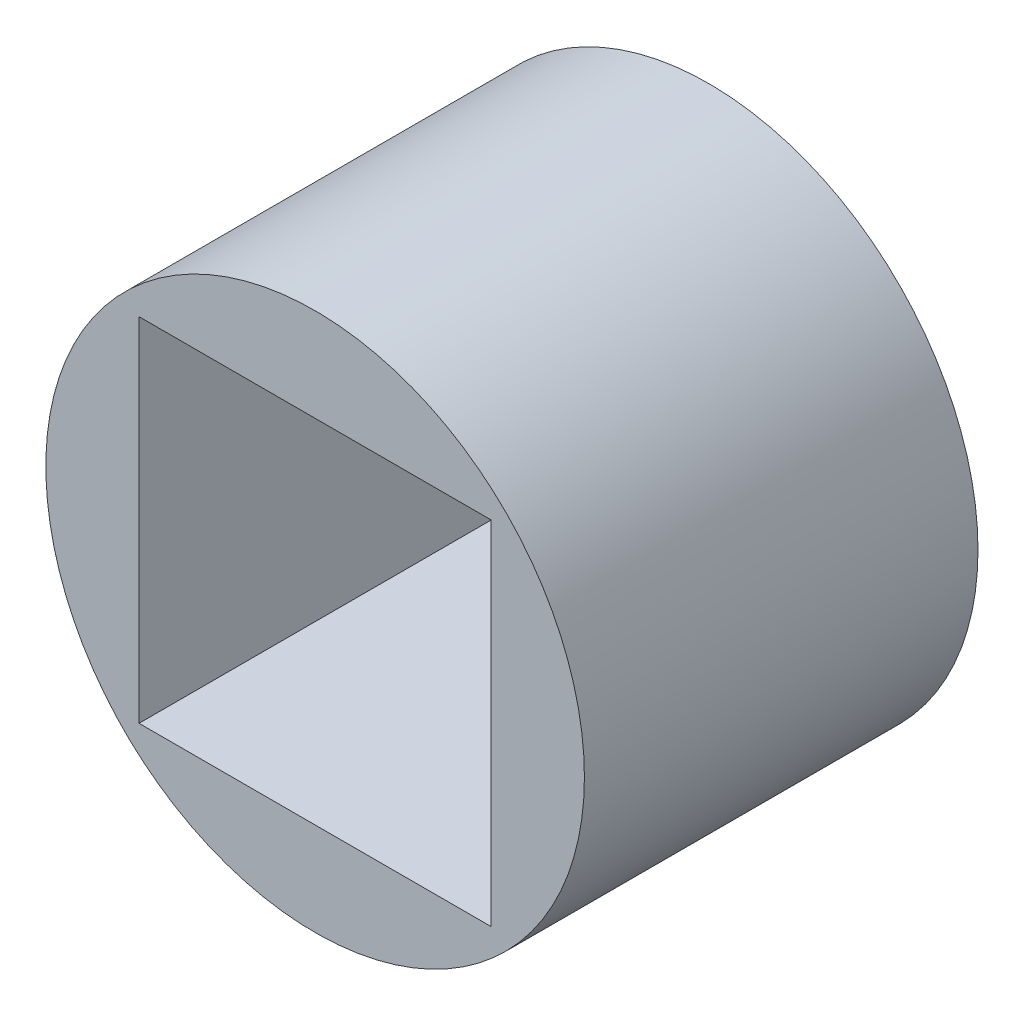
from build123d import *

# Parameters (mm, degrees)
SKETCH1_R           = 13
BOSS_EXTRUDE1_DEPTH = 19
SKETCH2_W           = 17
SKETCH2_H           = 17
CUT_EXTRUDE1_DEPTH  = 27.438608133
SKETCH3_W           = 1.338100332
SKETCH3_H           = 0.399847574
CUT_EXTRUDE2_DEPTH  = 1


with BuildPart() as part:
    # Sketch1 → Boss-Extrude1 (new body)
    with BuildSketch(Plane.XY):
        Circle(SKETCH1_R)
    extrude(amount=BOSS_EXTRUDE1_DEPTH)

    # Sketch2 → Cut-Extrude1 (cut, through all)
    with BuildSketch(Plane(origin=(0, 0, 0), x_dir=(-1, 0, 0), z_dir=(0, 0, -1))):
        Rectangle(SKETCH2_W, SKETCH2_H)
    extrude(amount=-CUT_EXTRUDE1_DEPTH, mode=Mode.SUBTRACT)

    # Sketch3 → Cut-Extrude2 (cut)
    with BuildSketch(Plane.XZ.offset(-8.5)):
        with BuildLine():
            add(Edge.make_bspline(
                [(-3.825462561, 7.998501817), (-3.8472395, 7.988683923), (-3.892165727, 7.968429426), (-3.964656685, 7.943438913), (-4.043322709, 7.920849207), (-4.158034022, 7.895766454), (-4.309873, 7.872453456), (-4.434074011, 7.868540933), (-4.497297615, 7.866549292)],
                knots=[0, 0, 0, 0, 0.623279357, 1.285836859, 1.999327964, 2.758722695, 4.350051821, 6, 6, 6, 6], degree=3))
            add(Edge.make_bspline(
                [(-4.497297615, 7.866549292), (-4.544517066, 7.867822116), (-4.636711485, 7.870307262), (-4.771142319, 7.888042222), (-4.897562598, 7.917463191), (-5.016054988, 7.958445975), (-5.126623729, 8.010722712), (-5.229306121, 8.07453212), (-5.324479717, 8.149401281), (-5.410267642, 8.236733372), (-5.488079827, 8.33375156), (-5.555215307, 8.441917538), (-5.612334828, 8.55986778), (-5.658692932, 8.6883202), (-5.695097594, 8.826651983), (-5.721458052, 8.974968663), (-5.738832003, 9.133266205), (-5.741316176, 9.242265926), (-5.742595401, 9.298395362)],
                knots=[0, 0, 0, 0, 1.05357022, 2.05706105, 3.019831997, 3.945549259, 4.849673394, 5.743319306, 6.637992512, 7.545159443, 8.469260999, 9.40786221, 10.379774602, 11.388606811, 12.450446757, 13.567948197, 14.747614263, 16, 16, 16, 16], degree=3))
            add(Edge.make_bspline(
                [(-5.742595401, 9.298395362), (-5.740839555, 9.357344336), (-5.737431344, 9.4717681), (-5.71890081, 9.637393975), (-5.69061878, 9.792016173), (-5.650226431, 9.934755031), (-5.601314628, 10.067238307), (-5.540767632, 10.187969396), (-5.469289697, 10.297433174), (-5.387211374, 10.394753746), (-5.297112011, 10.480418745), (-5.200605572, 10.555325418), (-5.097298035, 10.618118111), (-4.987570233, 10.669800158), (-4.871437604, 10.709993799), (-4.749081641, 10.738915058), (-4.620270899, 10.755991273), (-4.532312435, 10.758052252), (-4.487442234, 10.759103618)],
                knots=[0, 0, 0, 0, 1.300058967, 2.523498372, 3.671327638, 4.762385131, 5.790754738, 6.781204902, 7.734179646, 8.667035103, 9.582038544, 10.471113154, 11.35590086, 12.242457161, 13.14087904, 14.060872889, 15.010794189, 16, 16, 16, 16], degree=3))
            add(Edge.make_bspline(
                [(-4.487442234, 10.759103618), (-4.453635771, 10.758545443), (-4.387809068, 10.757458584), (-4.291923773, 10.749549681), (-4.20157498, 10.737252335), (-4.117208774, 10.719144041), (-4.038155251, 10.699104788), (-3.965344922, 10.675556536), (-3.89768, 10.651537073), (-3.855861028, 10.632007753), (-3.835579176, 10.622536196)],
                knots=[0, 0, 0, 0, 1.208363836, 2.352881735, 3.437133088, 4.465326887, 5.435785295, 6.351019915, 7.200258411, 8, 8, 8, 8], degree=3))
            Line((-3.835579176, 10.622536196), (-3.713548715, 11.067115898))
            add(Edge.make_bspline(
                [(-3.713548715, 11.067115898), (-3.728780614, 11.074271907), (-3.763638168, 11.090648133), (-3.825085739, 11.111773726), (-3.901694354, 11.133026165), (-3.992569237, 11.156840394), (-4.099406756, 11.177391064), (-4.221778647, 11.191208874), (-4.359395075, 11.201365109), (-4.456212288, 11.203094008), (-4.507152996, 11.204003675)],
                knots=[0, 0, 0, 0, 0.497728815, 1.139031319, 1.919228026, 2.850533018, 3.918187005, 5.13515125, 6.492650013, 8, 8, 8, 8], degree=3))
            add(Edge.make_bspline(
                [(-4.507152996, 11.204003675), (-4.571520854, 11.202585263), (-4.697641023, 11.199806077), (-4.882374145, 11.175960191), (-5.057963075, 11.137542756), (-5.224767045, 11.083826883), (-5.382484292, 11.014738446), (-5.530921996, 10.929705154), (-5.670480956, 10.829901405), (-5.800125021, 10.715128055), (-5.918300001, 10.585476353), (-6.021609971, 10.440161667), (-6.109032731, 10.280044465), (-6.18091872, 10.105477848), (-6.237630959, 9.916766953), (-6.27970982, 9.713764265), (-6.306513382, 9.49617978), (-6.312056921, 9.346106465), (-6.314911455, 9.268829219)],
                knots=[0, 0, 0, 0, 1.03258902, 2.023219463, 2.983439502, 3.913466857, 4.830690834, 5.741453413, 6.65369381, 7.579319873, 8.515001589, 9.462699019, 10.433390624, 11.436184352, 12.486830696, 13.590904696, 14.759484638, 16, 16, 16, 16], degree=3))
            add(Edge.make_bspline(
                [(-6.314911455, 9.268829219), (-6.313035244, 9.195777488), (-6.309387091, 9.053733849), (-6.284596459, 8.847436339), (-6.247972277, 8.653778259), (-6.196856679, 8.472860413), (-6.131020876, 8.305138456), (-6.052331856, 8.149546165), (-5.957972622, 8.007596821), (-5.850982138, 7.878083443), (-5.730885174, 7.763539926), (-5.600843462, 7.662547159), (-5.459882189, 7.57781128), (-5.308694946, 7.50846802), (-5.147248795, 7.454247123), (-4.975395794, 7.414929133), (-4.79316224, 7.390811315), (-4.668198211, 7.386994984), (-4.604298894, 7.385043535)],
                knots=[0, 0, 0, 0, 1.218475598, 2.369234888, 3.461691683, 4.503752951, 5.500362793, 6.463244622, 7.406714516, 8.337948286, 9.259888006, 10.169706265, 11.079364509, 11.997173012, 12.939204436, 13.91536257, 14.934038004, 16, 16, 16, 16], degree=3))
            add(Edge.make_bspline(
                [(-4.604298894, 7.385043535), (-4.555000004, 7.385679709), (-4.459818747, 7.386907969), (-4.321997417, 7.397410376), (-4.194090481, 7.411475091), (-4.07661829, 7.431836437), (-3.97113093, 7.456597699), (-3.877897968, 7.48218342), (-3.79789667, 7.509696951), (-3.750484492, 7.531808929), (-3.728577896, 7.542025675)],
                knots=[0, 0, 0, 0, 1.319898282, 2.548324642, 3.699499855, 4.764539851, 5.738494737, 6.599877469, 7.353079316, 8, 8, 8, 8], degree=3))
            Line((-3.728577896, 7.542025675), (-3.825462561, 7.998501817))
        make_face()
        with BuildLine():
            add(Edge.make_bspline(
                [(-1.241951013, 11.044182338), (-1.263788296, 11.05396615), (-1.309962054, 11.074653493), (-1.38472728, 11.104174743), (-1.470203266, 11.128880989), (-1.564058953, 11.155217532), (-1.667821691, 11.175784789), (-1.780277996, 11.192416001), (-1.902159788, 11.20087307), (-1.986277734, 11.202934073), (-2.029932584, 11.204003675)],
                knots=[0, 0, 0, 0, 0.708710674, 1.498530526, 2.377842287, 3.342082284, 4.384700519, 5.508033759, 6.706739533, 8, 8, 8, 8], degree=3))
            add(Edge.make_bspline(
                [(-2.029932584, 11.204003675), (-2.075971056, 11.202857752), (-2.16570689, 11.200624179), (-2.296186023, 11.185165496), (-2.419347876, 11.163065719), (-2.534860232, 11.132343992), (-2.642812237, 11.092755462), (-2.742994253, 11.044544729), (-2.836723704, 10.989420863), (-2.921086311, 10.924115344), (-2.996955513, 10.852605042), (-3.063829961, 10.775469394), (-3.120570115, 10.692592598), (-3.167043924, 10.604159061), (-3.204304263, 10.510610715), (-3.229688087, 10.41117863), (-3.247510652, 10.306614747), (-3.250016873, 10.234733851), (-3.251295873, 10.198050856)],
                knots=[0, 0, 0, 0, 1.244497242, 2.425710392, 3.548112764, 4.625356038, 5.653037026, 6.651879843, 7.627834546, 8.587130278, 9.529579358, 10.442724556, 11.341923041, 12.238701188, 13.138772083, 14.057454209, 15.008660164, 16, 16, 16, 16], degree=3))
            add(Edge.make_bspline(
                [(-3.251295873, 10.198050856), (-3.249901851, 10.167042997), (-3.247155688, 10.105958848), (-3.234778001, 10.016225759), (-3.213068318, 9.930681627), (-3.185324334, 9.848274231), (-3.148133318, 9.770135774), (-3.104430916, 9.695012561), (-3.052979504, 9.623625705), (-2.993082511, 9.556941095), (-2.927833879, 9.492813556), (-2.856020958, 9.432367235), (-2.779645366, 9.373664728), (-2.696885409, 9.319179165), (-2.609624528, 9.266592633), (-2.516073509, 9.218480907), (-2.418043707, 9.171607796), (-2.349688684, 9.144097067), (-2.315034678, 9.130149929)],
                knots=[0, 0, 0, 0, 0.983051548, 1.936569266, 2.863283213, 3.775422207, 4.686621678, 5.599487379, 6.525873302, 7.468549941, 8.435790942, 9.421901335, 10.440348152, 11.485651887, 12.559097578, 13.666322711, 14.816893572, 16, 16, 16, 16], degree=3))
            add(Edge.make_bspline(
                [(-2.315034678, 9.130149929), (-2.287944283, 9.118888583), (-2.2354546, 9.097068875), (-2.160563734, 9.061326664), (-2.090764015, 9.026120198), (-2.027266878, 8.988276398), (-1.968801075, 8.950553247), (-1.915879485, 8.912080425), (-1.86895604, 8.872186429), (-1.827130077, 8.831597436), (-1.790991209, 8.788670588), (-1.758846286, 8.744649661), (-1.733037008, 8.697492073), (-1.710627713, 8.649088862), (-1.694797995, 8.597597475), (-1.682490589, 8.544502901), (-1.67636888, 8.488755856), (-1.675554849, 8.451079145), (-1.675138868, 8.431825789)],
                knots=[0, 0, 0, 0, 1.388122244, 2.689591594, 3.926249753, 5.086084925, 6.185666876, 7.218456479, 8.17963197, 9.098367537, 9.972816908, 10.832547089, 11.672764253, 12.512761244, 13.352097369, 14.216904389, 15.08881175, 16, 16, 16, 16], degree=3))
            add(Edge.make_bspline(
                [(-1.675138868, 8.431825789), (-1.67597274, 8.410920973), (-1.677600375, 8.370116835), (-1.685694253, 8.310491881), (-1.7009967, 8.25455145), (-1.720578677, 8.20132185), (-1.745738988, 8.151240683), (-1.777363619, 8.104971245), (-1.814216217, 8.061818266), (-1.856346759, 8.021839413), (-1.903714053, 7.985431227), (-1.95688737, 7.954980957), (-2.014302703, 7.927631133), (-2.076976943, 7.906199777), (-2.144382849, 7.889421171), (-2.216557253, 7.8766023), (-2.29376683, 7.8691288), (-2.346932266, 7.867423073), (-2.374166964, 7.866549292)],
                knots=[0, 0, 0, 0, 0.990521638, 1.933400576, 2.841729037, 3.731308652, 4.615877296, 5.488075707, 6.378765043, 7.298374163, 8.234022832, 9.200250136, 10.194442343, 11.241679568, 12.33047909, 13.48140951, 14.709818706, 16, 16, 16, 16], degree=3))
            add(Edge.make_bspline(
                [(-2.374166964, 7.866549292), (-2.412912319, 7.867696323), (-2.489639753, 7.869967789), (-2.603295724, 7.882019539), (-2.714001498, 7.90190164), (-2.821292487, 7.928338017), (-2.923020755, 7.961512284), (-3.018436486, 7.997831252), (-3.106402329, 8.038452427), (-3.160707868, 8.070046144), (-3.187235897, 8.085479542)],
                knots=[0, 0, 0, 0, 1.092028668, 2.162544593, 3.217073326, 4.259508439, 5.273710381, 6.230318055, 7.135517783, 8, 8, 8, 8], degree=3))
            Line((-3.187235897, 8.085479542), (-3.313848257, 7.611053215))
            add(Edge.make_bspline(
                [(-3.313848257, 7.611053215), (-3.288383989, 7.595209598), (-3.234809437, 7.561876039), (-3.143395836, 7.521258271), (-3.039772007, 7.483153878), (-2.924372037, 7.450297637), (-2.801240858, 7.422505103), (-2.673469289, 7.401032274), (-2.542197507, 7.38831249), (-2.45350616, 7.386141341), (-2.408660797, 7.385043535)],
                knots=[0, 0, 0, 0, 0.761703857, 1.602557085, 2.536844329, 3.567754473, 4.650347393, 5.744907002, 6.85974825, 8, 8, 8, 8], degree=3))
            add(Edge.make_bspline(
                [(-2.408660797, 7.385043535), (-2.357227351, 7.386679829), (-2.257163641, 7.389863236), (-2.11177971, 7.406288796), (-1.97566635, 7.431216817), (-1.849105369, 7.465590322), (-1.731773251, 7.509284369), (-1.624098715, 7.562829988), (-1.525295304, 7.624805231), (-1.437024501, 7.696296881), (-1.358971231, 7.775368275), (-1.290362697, 7.859891022), (-1.232057544, 7.949927193), (-1.184581552, 8.045574224), (-1.148007502, 8.147002151), (-1.121272273, 8.253556498), (-1.104627761, 8.365603887), (-1.102500062, 8.442092368), (-1.101414902, 8.481102694)],
                knots=[0, 0, 0, 0, 1.285635255, 2.501201915, 3.652546696, 4.740889107, 5.774566479, 6.77641306, 7.741186608, 8.683618437, 9.608349835, 10.513231835, 11.399760906, 12.283589774, 13.175918775, 14.08904847, 15.025384736, 16, 16, 16, 16], degree=3))
            add(Edge.make_bspline(
                [(-1.101414902, 8.481102694), (-1.101763494, 8.512111743), (-1.102452272, 8.573382049), (-1.113672627, 8.663242946), (-1.130229115, 8.749747373), (-1.154261651, 8.832473558), (-1.185320198, 8.911312594), (-1.222872553, 8.986930653), (-1.267974232, 9.058380264), (-1.319852336, 9.126651994), (-1.379060988, 9.191506657), (-1.444290041, 9.255232265), (-1.518030257, 9.315483167), (-1.598442869, 9.373940636), (-1.685725687, 9.430374065), (-1.780823516, 9.483665528), (-1.882417692, 9.536062644), (-1.953958229, 9.567456909), (-1.99051106, 9.583497455)],
                knots=[0, 0, 0, 0, 0.982432546, 1.941173421, 2.866157474, 3.772556858, 4.66774389, 5.549382036, 6.445187077, 7.342381083, 8.264158632, 9.22693172, 10.230873022, 11.279913627, 12.377701818, 13.523733624, 14.734779603, 16, 16, 16, 16], degree=3))
            add(Edge.make_bspline(
                [(-1.99051106, 9.583497455), (-2.019239874, 9.595471431), (-2.075202393, 9.61879623), (-2.15506156, 9.656561555), (-2.230016501, 9.692568562), (-2.29822759, 9.729958257), (-2.360505555, 9.767593688), (-2.417442827, 9.80443669), (-2.468311256, 9.841708405), (-2.513289906, 9.879486047), (-2.553456823, 9.918067782), (-2.587113735, 9.960056817), (-2.616545519, 10.003769576), (-2.639732071, 10.050454325), (-2.657480324, 10.099635301), (-2.670029434, 10.151317604), (-2.678148904, 10.205535902), (-2.678700199, 10.24260516), (-2.678979819, 10.261406877)],
                knots=[0, 0, 0, 0, 1.446151426, 2.817042004, 4.104511442, 5.309840431, 6.430035124, 7.485576682, 8.46047753, 9.358229411, 10.214145413, 11.043532412, 11.854067244, 12.658712552, 13.458986568, 14.278856642, 15.12702727, 16, 16, 16, 16], degree=3))
            add(Edge.make_bspline(
                [(-2.678979819, 10.261406877), (-2.6775671, 10.292359525), (-2.674768657, 10.353673385), (-2.645459298, 10.442901941), (-2.596979097, 10.526139096), (-2.542475363, 10.590177571), (-2.489133491, 10.636553977), (-2.442200219, 10.667574063), (-2.389732048, 10.694312392), (-2.331780746, 10.716894392), (-2.26807743, 10.734453556), (-2.198481857, 10.746544702), (-2.123569717, 10.756185792), (-2.07149858, 10.758112573), (-2.044715656, 10.759103618)],
                knots=[0, 0, 0, 0, 1.231149178, 2.438773903, 3.700595415, 5.054760875, 5.77143522, 6.513803205, 7.292337816, 8.116133825, 8.99032737, 9.922842231, 10.931608527, 12, 12, 12, 12], degree=3))
            add(Edge.make_bspline(
                [(-2.044715656, 10.759103618), (-2.007137886, 10.757973408), (-1.934164968, 10.755778635), (-1.829105151, 10.744213781), (-1.731439564, 10.728022747), (-1.642920632, 10.703652291), (-1.563168018, 10.676774244), (-1.492459444, 10.650382145), (-1.431653685, 10.623293711), (-1.395543736, 10.603067504), (-1.378773482, 10.593674008)],
                knots=[0, 0, 0, 0, 1.30070927, 2.525869749, 3.655481973, 4.723256875, 5.699209223, 6.568037488, 7.334965145, 8, 8, 8, 8], degree=3))
            Line((-1.378773482, 10.593674008), (-1.241951013, 11.044182338))
        make_face()
        with BuildLine():
            add(Edge.make_bspline(
                [(1.371132866, 11.044182338), (1.349295583, 11.05396615), (1.303121824, 11.074653493), (1.228356599, 11.104174743), (1.142880613, 11.128880989), (1.049024926, 11.155217532), (0.945262187, 11.175784789), (0.832805882, 11.192416001), (0.71092409, 11.20087307), (0.626806145, 11.202934073), (0.583151294, 11.204003675)],
                knots=[0, 0, 0, 0, 0.708710674, 1.498530526, 2.377842287, 3.342082284, 4.384700519, 5.508033759, 6.706739533, 8, 8, 8, 8], degree=3))
            add(Edge.make_bspline(
                [(0.583151294, 11.204003675), (0.537112823, 11.202857752), (0.447376988, 11.200624179), (0.316897856, 11.185165496), (0.193736003, 11.163065719), (0.078223647, 11.132343992), (-0.029728359, 11.092755462), (-0.129910374, 11.044544729), (-0.223639826, 10.989420863), (-0.308002433, 10.924115344), (-0.383871634, 10.852605042), (-0.450746083, 10.775469394), (-0.507486236, 10.692592598), (-0.553960045, 10.604159061), (-0.591220384, 10.510610715), (-0.616604209, 10.41117863), (-0.634426773, 10.306614747), (-0.636932994, 10.234733851), (-0.638211995, 10.198050856)],
                knots=[0, 0, 0, 0, 1.244497242, 2.425710392, 3.548112764, 4.625356038, 5.653037026, 6.651879843, 7.627834546, 8.587130278, 9.529579358, 10.442724556, 11.341923041, 12.238701188, 13.138772083, 14.057454209, 15.008660164, 16, 16, 16, 16], degree=3))
            add(Edge.make_bspline(
                [(-0.638211995, 10.198050856), (-0.636817973, 10.167042997), (-0.63407181, 10.105958848), (-0.621694123, 10.016225759), (-0.599984439, 9.930681627), (-0.572240455, 9.848274231), (-0.535049439, 9.770135774), (-0.491347038, 9.695012561), (-0.439895625, 9.623625705), (-0.379998632, 9.556941095), (-0.31475, 9.492813556), (-0.242937079, 9.432367235), (-0.166561488, 9.373664728), (-0.08380153, 9.319179165), (0.003459351, 9.266592633), (0.097010369, 9.218480907), (0.195040171, 9.171607796), (0.263395195, 9.144097067), (0.298049201, 9.130149929)],
                knots=[0, 0, 0, 0, 0.983051548, 1.936569266, 2.863283213, 3.775422207, 4.686621678, 5.599487379, 6.525873302, 7.468549941, 8.435790942, 9.421901335, 10.440348152, 11.485651887, 12.559097578, 13.666322711, 14.816893572, 16, 16, 16, 16], degree=3))
            add(Edge.make_bspline(
                [(0.298049201, 9.130149929), (0.325139595, 9.118888583), (0.377629279, 9.097068875), (0.452520145, 9.061326664), (0.522319863, 9.026120198), (0.585817, 8.988276398), (0.644282803, 8.950553247), (0.697204393, 8.912080425), (0.744127838, 8.872186429), (0.785953801, 8.831597436), (0.82209267, 8.788670588), (0.854237593, 8.744649661), (0.880046871, 8.697492073), (0.902456166, 8.649088862), (0.918285884, 8.597597475), (0.93059329, 8.544502901), (0.936714999, 8.488755856), (0.937529029, 8.451079145), (0.937945011, 8.431825789)],
                knots=[0, 0, 0, 0, 1.388122244, 2.689591594, 3.926249753, 5.086084925, 6.185666876, 7.218456479, 8.17963197, 9.098367537, 9.972816908, 10.832547089, 11.672764253, 12.512761244, 13.352097369, 14.216904389, 15.08881175, 16, 16, 16, 16], degree=3))
            add(Edge.make_bspline(
                [(0.937945011, 8.431825789), (0.937111139, 8.410920973), (0.935483503, 8.370116835), (0.927389625, 8.310491881), (0.912087178, 8.25455145), (0.892505201, 8.20132185), (0.867344891, 8.151240683), (0.835720259, 8.104971245), (0.798867661, 8.061818266), (0.756737119, 8.021839413), (0.709369826, 7.985431227), (0.656196509, 7.954980957), (0.598781175, 7.927631133), (0.536106936, 7.906199777), (0.46870103, 7.889421171), (0.396526626, 7.8766023), (0.319317048, 7.8691288), (0.266151613, 7.867423073), (0.238916915, 7.866549292)],
                knots=[0, 0, 0, 0, 0.990521638, 1.933400576, 2.841729037, 3.731308652, 4.615877296, 5.488075707, 6.378765043, 7.298374163, 8.234022832, 9.200250136, 10.194442343, 11.241679568, 12.33047909, 13.48140951, 14.709818706, 16, 16, 16, 16], degree=3))
            add(Edge.make_bspline(
                [(0.238916915, 7.866549292), (0.20017156, 7.867696323), (0.123444126, 7.869967789), (0.009788154, 7.882019539), (-0.10091762, 7.90190164), (-0.208208609, 7.928338017), (-0.309936876, 7.961512284), (-0.405352608, 7.997831252), (-0.493318451, 8.038452427), (-0.54762399, 8.070046144), (-0.574152018, 8.085479542)],
                knots=[0, 0, 0, 0, 1.092028668, 2.162544593, 3.217073326, 4.259508439, 5.273710381, 6.230318055, 7.135517783, 8, 8, 8, 8], degree=3))
            Line((-0.574152018, 8.085479542), (-0.700764378, 7.611053215))
            add(Edge.make_bspline(
                [(-0.700764378, 7.611053215), (-0.675300111, 7.595209598), (-0.621725558, 7.561876039), (-0.530311957, 7.521258271), (-0.426688128, 7.483153878), (-0.311288159, 7.450297637), (-0.18815698, 7.422505103), (-0.060385411, 7.401032274), (0.070886371, 7.38831249), (0.159577718, 7.386141341), (0.204423081, 7.385043535)],
                knots=[0, 0, 0, 0, 0.761703857, 1.602557085, 2.536844329, 3.567754473, 4.650347393, 5.744907002, 6.85974825, 8, 8, 8, 8], degree=3))
            add(Edge.make_bspline(
                [(0.204423081, 7.385043535), (0.255856527, 7.386679829), (0.355920238, 7.389863236), (0.501304169, 7.406288796), (0.637417528, 7.431216817), (0.76397851, 7.465590322), (0.881310628, 7.509284369), (0.988985164, 7.562829988), (1.087788575, 7.624805231), (1.176059377, 7.696296881), (1.254112648, 7.775368275), (1.322721181, 7.859891022), (1.381026334, 7.949927193), (1.428502326, 8.045574224), (1.465076376, 8.147002151), (1.491811606, 8.253556498), (1.508456118, 8.365603887), (1.510583817, 8.442092368), (1.511668976, 8.481102694)],
                knots=[0, 0, 0, 0, 1.285635255, 2.501201915, 3.652546696, 4.740889107, 5.774566479, 6.77641306, 7.741186608, 8.683618437, 9.608349835, 10.513231835, 11.399760906, 12.283589774, 13.175918775, 14.08904847, 15.025384736, 16, 16, 16, 16], degree=3))
            add(Edge.make_bspline(
                [(1.511668976, 8.481102694), (1.511320384, 8.512111743), (1.510631606, 8.573382049), (1.499411252, 8.663242946), (1.482854764, 8.749747373), (1.458822228, 8.832473558), (1.42776368, 8.911312594), (1.390211325, 8.986930653), (1.345109646, 9.058380264), (1.293231543, 9.126651994), (1.23402289, 9.191506657), (1.168793837, 9.255232265), (1.095053621, 9.315483167), (1.01464101, 9.373940636), (0.927358192, 9.430374065), (0.832260362, 9.483665528), (0.730666186, 9.536062644), (0.659125649, 9.567456909), (0.622572818, 9.583497455)],
                knots=[0, 0, 0, 0, 0.982432546, 1.941173421, 2.866157474, 3.772556858, 4.66774389, 5.549382036, 6.445187077, 7.342381083, 8.264158632, 9.22693172, 10.230873022, 11.279913627, 12.377701818, 13.523733624, 14.734779603, 16, 16, 16, 16], degree=3))
            add(Edge.make_bspline(
                [(0.622572818, 9.583497455), (0.593844004, 9.595471431), (0.537881486, 9.61879623), (0.458022318, 9.656561555), (0.383067378, 9.692568562), (0.314856289, 9.729958257), (0.252578324, 9.767593688), (0.195641052, 9.80443669), (0.144772623, 9.841708405), (0.099793972, 9.879486047), (0.059627055, 9.918067782), (0.025970144, 9.960056817), (-0.003461641, 10.003769576), (-0.026648192, 10.050454325), (-0.044396445, 10.099635301), (-0.056945556, 10.151317604), (-0.065065025, 10.205535902), (-0.065616321, 10.24260516), (-0.065895941, 10.261406877)],
                knots=[0, 0, 0, 0, 1.446151426, 2.817042004, 4.104511442, 5.309840431, 6.430035124, 7.485576682, 8.46047753, 9.358229411, 10.214145413, 11.043532412, 11.854067244, 12.658712552, 13.458986568, 14.278856642, 15.12702727, 16, 16, 16, 16], degree=3))
            add(Edge.make_bspline(
                [(-0.065895941, 10.261406877), (-0.064483222, 10.292359525), (-0.061684779, 10.353673385), (-0.032375419, 10.442901941), (0.016104781, 10.526139096), (0.070608516, 10.590177571), (0.123950388, 10.636553977), (0.170883659, 10.667574063), (0.223351831, 10.694312392), (0.281303132, 10.716894392), (0.345006448, 10.734453556), (0.414602021, 10.746544702), (0.489514161, 10.756185792), (0.541585299, 10.758112573), (0.568368223, 10.759103618)],
                knots=[0, 0, 0, 0, 1.231149178, 2.438773903, 3.700595415, 5.054760875, 5.77143522, 6.513803205, 7.292337816, 8.116133825, 8.99032737, 9.922842231, 10.931608527, 12, 12, 12, 12], degree=3))
            add(Edge.make_bspline(
                [(0.568368223, 10.759103618), (0.605945992, 10.757973408), (0.678918911, 10.755778635), (0.783978727, 10.744213781), (0.881644315, 10.728022747), (0.970163247, 10.703652291), (1.049915861, 10.676774244), (1.120624434, 10.650382145), (1.181430193, 10.623293711), (1.217540143, 10.603067504), (1.234310397, 10.593674008)],
                knots=[0, 0, 0, 0, 1.30070927, 2.525869749, 3.655481973, 4.723256875, 5.699209223, 6.568037488, 7.334965145, 8, 8, 8, 8], degree=3))
            Line((1.234310397, 10.593674008), (1.371132866, 11.044182338))
        make_face()
        with Locations((2.554227496, 8.887284839)):
            Rectangle(SKETCH3_W, SKETCH3_H)
        Polygon((5.160271817, 7.42587297), (5.160271817, 11.069547432), (4.703632747, 11.069547432), (3.879510196, 10.648930413), (4.0060215, 10.23898616), (4.623980562, 10.579593518), (4.633712201, 10.579593518), (4.633712201, 7.431408373), align=None)
    extrude(amount=-CUT_EXTRUDE2_DEPTH, mode=Mode.SUBTRACT)


solid = part.part
